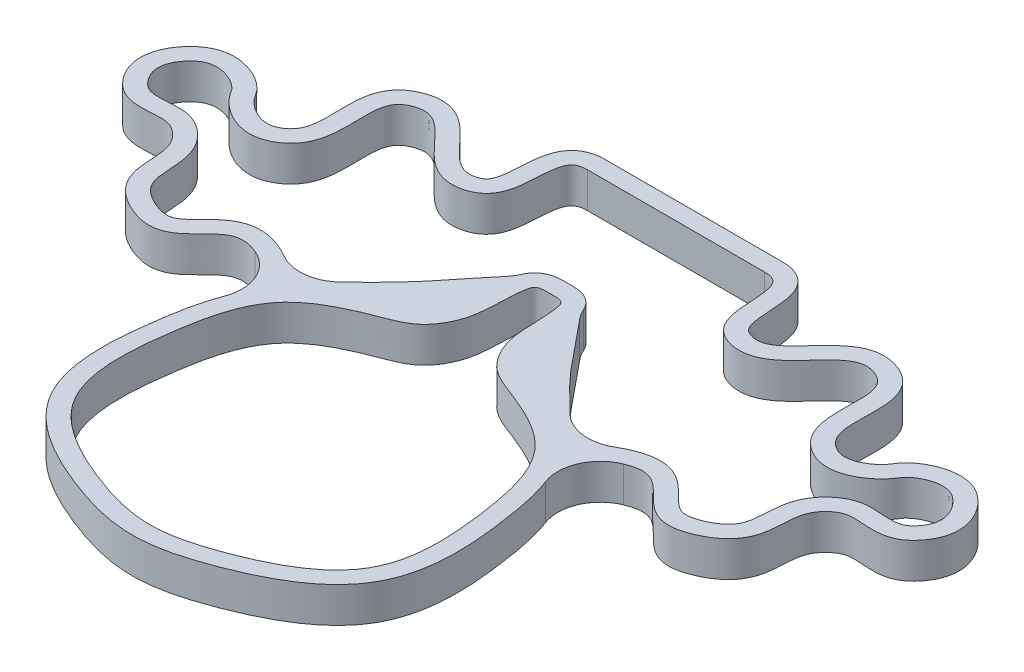
from build123d import *
from build123d.topology import SkipClean

# Parameters (mm, degrees)
BOSS_EXTRUDE1_DEPTH = 10
BOSS_EXTRUDE2_DEPTH = 10
BOSS_EXTRUDE3_REACH = 176.837
SKETCH5_W           = 5
SKETCH5_H           = 10
BOSS_EXTRUDE4_DEPTH = 10
CUT_EXTRUDE1_DEPTH  = 10
FILLET1_R           = 12


# Read off the part's stored shape, not the designer's step: Boss-Extrude1, Cut-Extrude1
with BuildPart() as part:
    # Boss-Extrude1 outline → Boss-Extrude1 (new body)
    with BuildSketch(Plane(origin=(0, 0, 0), x_dir=(1, 0, 0), z_dir=(0, 1, 0))):
        with BuildLine():
            add(Edge.make_bspline(
                [(0, 68), (-0.229955016, 68), (-0.689865049, 68.004974728), (-1.591414553, 68.002520989), (-2.663266621, 67.942332713), (-3.975675477, 67.733039222), (-5.328232552, 67.264665196), (-6.494121542, 66.549259145), (-7.346603188, 65.813842008), (-8.071785617, 64.907860236), (-8.702261378, 63.789000687), (-9.114098701, 62.590139977), (-9.346552866, 61.453066474), (-9.466907202, 60.596563457), (-9.560505535, 59.844888938), (-9.667772758, 58.831893117), (-9.766560612, 57.615782215), (-9.845951195, 56.216546964), (-9.90010575, 54.884121927), (-9.956888501, 53.194703593), (-10.030517689, 51.246803133), (-10.206000698, 49.158632524), (-10.524781985, 47.290194827), (-11.042323658, 45.551143123), (-11.8274076, 43.808085659), (-12.810187918, 42.261131322), (-13.738158049, 41.226169627), (-14.474995423, 40.606305144), (-15.343997305, 40.00496245), (-16.706020449, 39.2810116), (-18.761879479, 38.43451401), (-21.209735443, 37.516956832), (-23.750098329, 36.499006083), (-27.137875042, 35.028743538), (-31.346117134, 32.908554215), (-35.331632412, 30.249788348), (-38.25092656, 27.686652161), (-40.938574749, 24.766384761), (-43.57436943, 20.702748431), (-45.80484171, 15.458780742), (-47.348387511, 10.010298069), (-48.419992465, 4.454868396), (-49.217209103, -1.048797751), (-49.856507687, -6.67454438), (-50.167942636, -12.36440955), (-50.005406991, -18.04347673), (-49.19091454, -23.646379545), (-47.793096305, -28.178380739), (-46.133686884, -31.642292326), (-44.075306846, -34.949636813), (-40.934218174, -38.562379143), (-36.531759568, -42.206534709), (-31.702967125, -45.273678326), (-26.614712032, -47.873585483), (-21.421784466, -50.08078529), (-16.288403945, -51.989197765), (-11.013101748, -53.596173502), (-5.608553423, -54.70769409), (0, -55.146152955), (5.608553423, -54.70769409), (11.013101748, -53.596173502), (16.288403945, -51.989197765), (21.421784466, -50.08078529), (26.614712032, -47.873585483), (31.702967125, -45.273678326), (36.531759568, -42.206534709), (40.934218174, -38.562379143), (44.075306846, -34.949636813), (46.133686884, -31.642292326), (47.793096305, -28.178380739), (49.19091454, -23.646379545), (50.005406991, -18.04347673), (50.167942636, -12.36440955), (49.856507687, -6.67454438), (49.217209103, -1.048797751), (48.419992465, 4.454868396), (47.348387511, 10.010298069), (45.80484171, 15.458780742), (43.57436943, 20.702748431), (40.938574749, 24.766384761), (38.25092656, 27.686652161), (35.331632412, 30.249788348), (31.346117134, 32.908554215), (27.137875042, 35.028743538), (23.750098329, 36.499006083), (21.209735443, 37.516956832), (18.761879479, 38.43451401), (16.706020449, 39.2810116), (15.343997305, 40.00496245), (14.474995423, 40.606305144), (13.738158049, 41.226169627), (12.810187918, 42.261131322), (11.8274076, 43.808085659), (11.042323658, 45.551143123), (10.524781985, 47.290194827), (10.206000698, 49.158632524), (10.030517689, 51.246803133), (9.956888501, 53.194703593), (9.90010575, 54.884121927), (9.845951195, 56.216546964), (9.766560612, 57.615782215), (9.667772758, 58.831893117), (9.560505535, 59.844888938), (9.466907202, 60.596563457), (9.346552866, 61.453066474), (9.114098701, 62.590139977), (8.702261378, 63.789000687), (8.071785617, 64.907860236), (7.346603188, 65.813842008), (6.494121542, 66.549259145), (5.328232552, 67.264665196), (3.975675477, 67.733039222), (2.663266621, 67.942332713), (1.591414553, 68.002520989), (0.689865049, 68.004974728), (0.229955016, 68), (0, 68)],
                knots=[0, 0, 0, 0, 0.001953125, 0.00390625, 0.005859375, 0.0078125, 0.009765625, 0.010742188, 0.01171875, 0.012695312, 0.013671875, 0.015625, 0.017578125, 0.01953125, 0.021484375, 0.0234375, 0.02734375, 0.03125, 0.03515625, 0.0390625, 0.046875, 0.0546875, 0.0625, 0.0703125, 0.078125, 0.0859375, 0.09375, 0.09765625, 0.1015625, 0.109375, 0.1171875, 0.125, 0.1328125, 0.140625, 0.15625, 0.171875, 0.1796875, 0.1875, 0.203125, 0.21875, 0.234375, 0.25, 0.265625, 0.28125, 0.296875, 0.3125, 0.328125, 0.34375, 0.3515625, 0.359375, 0.375, 0.390625, 0.40625, 0.421875, 0.4375, 0.453125, 0.46875, 0.484375, 0.5, 0.515625, 0.53125, 0.546875, 0.5625, 0.578125, 0.59375, 0.609375, 0.625, 0.640625, 0.6484375, 0.65625, 0.671875, 0.6875, 0.703125, 0.71875, 0.734375, 0.75, 0.765625, 0.78125, 0.796875, 0.8125, 0.8203125, 0.828125, 0.84375, 0.859375, 0.8671875, 0.875, 0.8828125, 0.890625, 0.8984375, 0.90234375, 0.90625, 0.9140625, 0.921875, 0.9296875, 0.9375, 0.9453125, 0.953125, 0.9609375, 0.96484375, 0.96875, 0.97265625, 0.9765625, 0.978515625, 0.98046875, 0.982421875, 0.984375, 0.986328125, 0.987304688, 0.98828125, 0.989257812, 0.990234375, 0.9921875, 0.994140625, 0.99609375, 0.998046875, 1, 1, 1, 1], degree=3))
        make_face()
        with BuildLine():
            add(Edge.make_bspline(
                [(0, 63), (-1.52652089, 63), (-3.986940007, 63.159481514), (-5.346196174, 55.274620078), (-4.149353373, 46.810195668), (-10.242716569, 36.151969235), (-22.370270069, 31.936434422), (-39.510854167, 23.948082796), (-45.007896798, -1.712817306), (-46.722154478, -32.350862611), (-21.102343681, -45.688135745), (0, -51.703869298), (21.102343681, -45.688135745), (46.722154478, -32.350862611), (45.007896798, -1.712817306), (39.510854167, 23.948082796), (22.370270069, 31.936434422), (10.242716569, 36.151969235), (4.149353373, 46.810195668), (5.346196174, 55.274620078), (3.986940007, 63.159481514), (1.52652089, 63), (0, 63)],
                knots=[0, 0, 0, 0, 0.012028603, 0.019387488, 0.066377658, 0.095784615, 0.123665083, 0.184474112, 0.260640782, 0.354546782, 0.442522942, 0.5, 0.557477058, 0.645453218, 0.739359218, 0.815525888, 0.876334917, 0.904215385, 0.933622342, 0.980612512, 0.987971397, 1, 1, 1, 1], degree=3))
        make_face(mode=Mode.SUBTRACT)
    extrude(amount=BOSS_EXTRUDE1_DEPTH)

    # Sketch4 → Boss-Extrude2 (add)
    with BuildSketch(Plane(origin=(0, 0, 0), x_dir=(1, 0, 0), z_dir=(0, 1, 0))):
        with BuildLine():
            Line((25, 98.528473189), (25, 103.528473189))
            add(Edge.make_bspline(
                [(39.280273452, 22.807206451), (39.540497242, 23.040479628), (40.069307476, 23.509843419), (41.087670869, 24.39503951), (42.321082568, 25.432415063), (43.728799056, 26.560876691), (45.514768102, 27.918593123), (47.578036741, 29.348078948), (49.792570042, 30.666821967), (51.752529033, 31.622575442), (54.037690004, 32.464470121), (56.296678785, 32.815169434), (58.291772973, 32.522349553), (60.609911094, 31.453709864), (62.863993034, 29.314236059), (65.324781622, 26.778620512), (67.451197431, 24.932085682), (69.686631057, 23.694406793), (71.801854319, 23.149373865), (74.117916562, 23.00225994), (76.95679035, 23.53585364), (80.169052248, 24.786028729), (82.964895639, 26.384949347), (85.888137035, 28.774824271), (88.136048081, 32.298780809), (88.983578985, 36.549446587), (89.125147682, 40.383830989), (89.365588353, 43.19400065), (89.898580269, 45.180286841), (90.525609432, 46.5780955), (91.465235489, 47.940110502), (92.885506347, 49.351283221), (94.622069112, 50.477308787), (96.220364341, 50.976444537), (98.339151016, 51.060467174), (100.877654022, 50.866481544), (103.723679195, 50.705274451), (106.339347499, 50.964858257), (108.490136406, 51.700467505), (110.07990785, 52.590727339), (111.506372632, 53.793417627), (113.121003443, 55.602325578), (114.649781907, 58.103901748), (115.84055282, 62.17254608), (115.197304487, 66.978497821), (112.987817287, 70.663075399), (110.907120908, 72.92453274), (108.764920949, 74.71284465), (105.815324594, 76.131077973), (102.146063317, 76.521730573), (98.684539008, 75.972088957), (95.556775506, 74.765347188), (93.324011516, 73.380225468), (91.82987865, 72.118399235), (90.841622484, 71.061291297), (90.118043328, 70.009866834), (89.632766452, 69.239404631), (89.166105564, 68.619581134), (88.470178205, 67.873952018), (87.620610831, 67.120780313), (86.315377567, 66.156696611), (84.450458215, 65.150477325), (82.522417609, 64.648950803), (81.051314114, 64.626038697), (80.00447102, 64.798659034), (78.904621559, 65.211717567), (77.815550782, 65.848012472), (76.865213753, 66.635714613), (75.916344046, 67.750930074), (75.111699058, 69.410489967), (74.608967967, 71.973577283), (74.492348654, 74.987637545), (74.574768217, 78.273062647), (74.616331496, 81.689491508), (74.33333175, 85.141753053), (73.355404879, 88.569494923), (71.542446002, 91.19520065), (69.411569663, 92.848204452), (67.034555159, 94.11508731), (64.397676802, 94.873883059), (61.662464274, 94.967980008), (59.067173807, 94.548524737), (56.218779954, 93.251540251), (53.386143682, 91.025712479), (50.89957423, 88.501480969), (48.598243925, 85.956578591), (46.387698276, 83.670082457), (44.233645082, 81.921464104), (42.199525684, 80.930170957), (40.50693809, 80.721456324), (38.958071084, 80.968037181), (37.909999173, 81.352746609), (37.11688206, 81.86873264), (36.615722999, 82.434118274), (36.142456376, 83.327617037), (35.647415583, 84.96181936), (35.318585141, 87.705455874), (35.153777965, 91.550170831), (34.828694586, 94.880652528), (34.138829361, 97.502183402), (33.281291076, 99.413042742), (31.936006754, 101.168293906), (30.040512437, 102.545323494), (28.096794455, 103.223545611), (26.392484735, 103.485746429), (25.457793743, 103.528473189), (25, 103.528473189)],
                knots=[0, 0, 0, 0, 0.000976562, 0.001953125, 0.00390625, 0.005859375, 0.0078125, 0.01171875, 0.015625, 0.01953125, 0.0234375, 0.03125, 0.0390625, 0.046875, 0.0625, 0.0703125, 0.078125, 0.0859375, 0.08984375, 0.09375, 0.1015625, 0.109375, 0.1171875, 0.125, 0.140625, 0.15625, 0.171875, 0.1875, 0.1953125, 0.203125, 0.2109375, 0.21875, 0.2265625, 0.234375, 0.2421875, 0.25, 0.2578125, 0.265625, 0.26953125, 0.2734375, 0.27734375, 0.28125, 0.2890625, 0.296875, 0.3125, 0.328125, 0.3359375, 0.34375, 0.359375, 0.375, 0.390625, 0.40625, 0.421875, 0.4296875, 0.4375, 0.4453125, 0.453125, 0.4609375, 0.46875, 0.4765625, 0.484375, 0.5, 0.515625, 0.5234375, 0.53125, 0.5390625, 0.546875, 0.5546875, 0.5625, 0.578125, 0.59375, 0.609375, 0.625, 0.640625, 0.65625, 0.671875, 0.6875, 0.6953125, 0.703125, 0.71875, 0.7265625, 0.734375, 0.75, 0.765625, 0.78125, 0.796875, 0.8125, 0.828125, 0.84375, 0.859375, 0.8671875, 0.875, 0.8828125, 0.890625, 0.8984375, 0.90625, 0.921875, 0.9375, 0.953125, 0.9609375, 0.96875, 0.9765625, 0.984375, 0.9921875, 0.99609375, 1, 1, 1, 1], degree=3))
            Line((39.280273452, 22.807206451), (35.942793549, 26.530273452))
            add(Edge.make_bspline(
                [(35.942793549, 26.530273452), (36.480411154, 27.012211584), (37.587725238, 27.985269166), (39.142550797, 29.292491372), (40.648796847, 30.500373795), (42.576541654, 31.965972213), (44.851216403, 33.543644467), (47.385983827, 35.055969237), (49.752473836, 36.214017112), (52.715555819, 37.313522522), (56.123381212, 37.894884608), (59.76016467, 37.390512941), (62.750044902, 35.962678449), (65.120376172, 34.093666638), (67.086506173, 32.137201171), (68.822031902, 30.357476208), (70.421480612, 29.000465879), (71.629018254, 28.361152557), (72.599477451, 28.116799525), (73.64379084, 28.039028763), (75.519043963, 28.348154869), (78.011213831, 29.315518456), (80.169178409, 30.556284666), (81.625794359, 31.768320808), (82.601806488, 32.96775019), (83.459452682, 34.603624076), (83.982486016, 36.970602423), (84.13327561, 40.515185016), (84.435524755, 44.596410705), (85.645793722, 48.333598622), (87.642254221, 51.207667756), (89.706184644, 53.243815993), (91.885234163, 54.694783512), (93.932494984, 55.523186675), (96.071973265, 56.001222873), (98.574443936, 56.060244839), (101.31022046, 55.845638802), (103.724175433, 55.724375569), (105.357300329, 55.914051059), (106.4488041, 56.296447628), (107.19306877, 56.708915864), (107.986096066, 57.367802328), (108.785816066, 58.256730427), (109.468195681, 59.236590084), (110.124570307, 60.48382011), (110.539119141, 61.927534773), (110.568081527, 63.5599035), (110.206003423, 65.157255677), (109.503216745, 66.696540872), (108.544616115, 68.103738148), (107.44053852, 69.302170904), (106.359768758, 70.194329103), (105.39196185, 70.765799616), (104.102086897, 71.25644809), (102.317713225, 71.466890102), (100.015788909, 71.115462757), (97.788118936, 70.259141251), (96.219337923, 69.281863125), (95.25813652, 68.461763617), (94.746146789, 67.910242776), (94.35558235, 67.353501317), (93.80673232, 66.47605832), (92.966849354, 65.352229443), (91.951675939, 64.277557466), (90.766820076, 63.225619576), (88.97598914, 61.904916321), (86.370883087, 60.484838921), (83.329125016, 59.663338478), (80.706230251, 59.607562649), (78.667916871, 59.947029446), (76.716564393, 60.689937993), (74.943702282, 61.730854605), (73.364985352, 63.029458574), (71.616771757, 65.074314571), (70.272371738, 67.947700061), (69.397949885, 72.688570631), (69.568973227, 77.372583906), (69.61124965, 81.587844979), (69.367537063, 84.337281101), (68.825069732, 86.117176583), (68.171445012, 87.230948289), (67.550436057, 87.952026159), (66.711706358, 88.61012177), (65.228625636, 89.41522645), (63.015127061, 90.023824656), (60.952188512, 89.874077389), (58.928583472, 88.992397292), (56.782328725, 87.341214034), (54.578834339, 85.114534934), (52.295208919, 82.589939081), (49.845488143, 80.046811308), (47.080103977, 77.761280104), (44.315200894, 76.358376473), (41.779580862, 75.812106262), (39.749955996, 75.767862409), (37.714939145, 76.097297308), (35.737449874, 76.80740647), (33.885314515, 77.96372834), (32.385310891, 79.656485263), (31.451295604, 81.527775183), (30.688105051, 84.119375444), (30.327395774, 87.428474754), (30.160899155, 91.298952555), (29.8624201, 94.12461988), (29.387823056, 95.874056039), (28.925047447, 96.867014235), (28.38853819, 97.543432215), (27.837672327, 97.94835261), (27.219134255, 98.219056135), (26.635983679, 98.385146459), (26.028515455, 98.480288217), (25.471278063, 98.521196793), (25.153903363, 98.528473189), (25, 98.528473189)],
                knots=[0, 0, 0, 0, 0.001953125, 0.00390625, 0.005859375, 0.0078125, 0.01171875, 0.015625, 0.01953125, 0.0234375, 0.03125, 0.0390625, 0.046875, 0.0546875, 0.0625, 0.0703125, 0.078125, 0.0859375, 0.08984375, 0.09375, 0.1015625, 0.109375, 0.1171875, 0.125, 0.1328125, 0.140625, 0.15625, 0.171875, 0.1875, 0.203125, 0.2109375, 0.21875, 0.2265625, 0.23046875, 0.234375, 0.2421875, 0.25, 0.2578125, 0.265625, 0.26953125, 0.2734375, 0.27734375, 0.28125, 0.28515625, 0.2890625, 0.296875, 0.3046875, 0.3125, 0.3203125, 0.328125, 0.3359375, 0.34375, 0.3515625, 0.359375, 0.375, 0.390625, 0.40625, 0.421875, 0.4296875, 0.4375, 0.4453125, 0.453125, 0.4609375, 0.46875, 0.4765625, 0.484375, 0.5, 0.515625, 0.5234375, 0.53125, 0.5390625, 0.546875, 0.5546875, 0.5625, 0.578125, 0.59375, 0.625, 0.640625, 0.65625, 0.671875, 0.6796875, 0.6875, 0.6953125, 0.703125, 0.71875, 0.734375, 0.75, 0.765625, 0.78125, 0.796875, 0.8125, 0.828125, 0.84375, 0.8515625, 0.859375, 0.8671875, 0.875, 0.8828125, 0.890625, 0.8984375, 0.90625, 0.921875, 0.9375, 0.953125, 0.9609375, 0.96875, 0.9765625, 0.984375, 0.98828125, 0.9921875, 0.99609375, 0.998046875, 1, 1, 1, 1], degree=3))
        make_face()
    boss_extrude2 = extrude(amount=BOSS_EXTRUDE2_DEPTH)

    # Mirror1: Boss-Extrude2 across plane
    with SkipClean():  # the faces are left unmerged after this step: merging them gives an invalid solid
        add(boss_extrude2.mirror(Plane(origin=(0, 0, 0), x_dir=(0, 0, 1), z_dir=(1, 0, 0))))
    add(part.part.scale(1), mode=Mode.REPLACE)  # the faces are merged on a copy

    # Sketch5 → Boss-Extrude3 (add, up to next)
    with BuildSketch(Plane(origin=(-25, 0, 0), x_dir=(0, 0, -1), z_dir=(1, 0, 0)), mode=Mode.PRIVATE) as boss_extrude3_sk1:
        with Locations((101.028473189, 5)):
            Rectangle(SKETCH5_W, SKETCH5_H)
    boss_extrude3_tool1 = extrude(boss_extrude3_sk1.sketch, amount=BOSS_EXTRUDE3_REACH, mode=Mode.PRIVATE) - part.part
    add(boss_extrude3_tool1.solids().sort_by_distance((-25, 5, -101.028473))[0])

    # Sketch6 → Boss-Extrude4 (add)
    with BuildSketch(Plane(origin=(0, 0, 0), x_dir=(1, 0, 0), z_dir=(0, 1, 0))):
        with BuildLine():
            add(Edge.make_bspline(
                [(-41.071615172, 24.375831098), (-40.808288357, 29.591021177), (-19.918389257, 44.979141392), (0, 80.652886558), (19.918389257, 44.979141392), (69.414690824, 8.518695361), (-41.87227804, 8.518695361), (-41.071615172, 24.375831098)],
                knots=[0, 0, 0, 0, 0.133666052, 0.296789696, 0.459913341, 0.593579392, 1, 1, 1, 1], degree=3))
        make_face()
    extrude(amount=BOSS_EXTRUDE4_DEPTH)

    # Cut-Extrude1 outline → Cut-Extrude1 (cut)
    with BuildSketch(Plane(origin=(0, 0, 0), x_dir=(1, 0, 0), z_dir=(0, 1, 0))):
        with BuildLine():
            add(Edge.make_bspline(
                [(38.284681232, 19.559646602), (37.541925284, 20.785488281), (33.040169176, 26.963738894), (22.370270069, 31.936434422), (10.242716569, 36.151969235), (4.149353373, 46.810195668), (5.346196174, 55.274620078), (3.986940007, 63.159481514), (0, 62.901052686), (-3.986940007, 63.159481514), (-5.346196174, 55.274620078), (-4.149353373, 46.810195668), (-10.242716569, 36.151969235), (-22.370270069, 31.936434422), (-33.040169176, 26.963738894), (-37.541925284, 20.785488281), (-38.284681232, 19.559646602)],
                knots=[0.801593522, 0.801593522, 0.801593522, 0.801593522, 0.815525888, 0.876334917, 0.904215385, 0.933622342, 0.980612512, 0.987971397, 1, 1.012028603, 1.019387488, 1.066377658, 1.095784615, 1.123665083, 1.184474112, 1.198406478, 1.198406478, 1.198406478, 1.198406478], degree=3))
            add(Edge.make_bspline(
                [(-38.284681232, 19.559646602), (-25.69702275, 10.124090193), (25.697022748, 10.124090192), (38.284681232, 19.559646602)],
                knots=[0.046456853, 0.046456853, 0.046456853, 0.046456853, 0.359963755, 0.359963755, 0.359963755, 0.359963755], degree=3))
        make_face()
    extrude(amount=CUT_EXTRUDE1_DEPTH, mode=Mode.SUBTRACT)

    # Fillet1
    fillet1_edges = [part.edges().sort_by_distance(p)[0] for p in [
        (9.150957565, 5, -62.33804186),
        (-9.150957565, 5, -62.33804186),
        (-41.071615172, 5, -24.375831098),
        (41.071615172, 5, -24.375831098),
        (38.956152632, 5, -29.12903151),
        (-38.956152632, 5, -29.12903151),
    ]]
    fillet(fillet1_edges, radius=FILLET1_R)


solid = part.part
